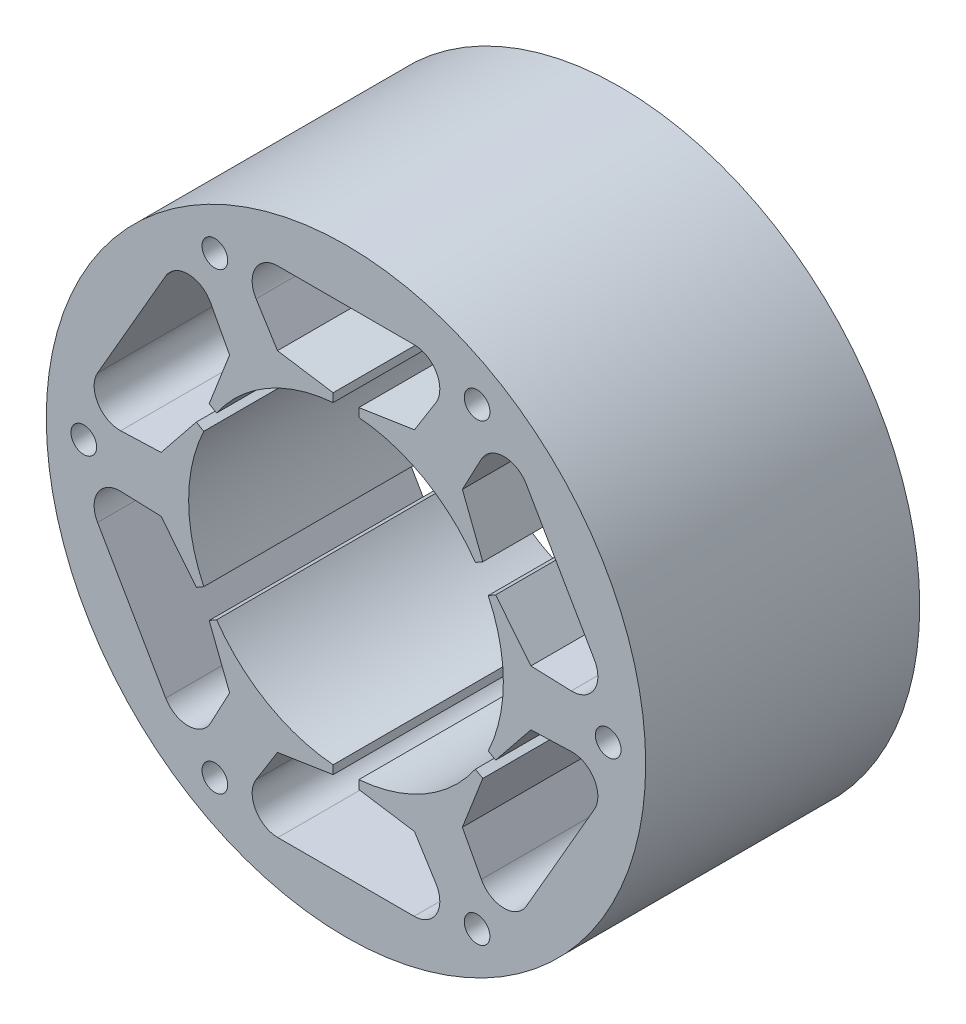
from build123d import *

# Parameters (mm, degrees)
IZIM2_R                     = 35
IZIM2_R_2                   = 1.5
Y_KSEKLIK_EKSTR_ZYON1_DEPTH = 32


with BuildPart() as part:
    # Çizim2 → Yükseklik-Ekstrüzyon1 (new body)
    with BuildSketch(Plane.XY):
        Circle(IZIM2_R)
        with Locations((-15.31013221, -26.517926859)):
            Circle(IZIM2_R_2, mode=Mode.SUBTRACT)
        with Locations((30.62026442, 0)):
            Circle(IZIM2_R_2, mode=Mode.SUBTRACT)
        with Locations((-15.31013221, 26.517926859)):
            Circle(IZIM2_R_2, mode=Mode.SUBTRACT)
        with Locations((15.31013221, 26.517926859)):
            Circle(IZIM2_R_2, mode=Mode.SUBTRACT)
        with Locations((15.31013221, -26.517926859)):
            Circle(IZIM2_R_2, mode=Mode.SUBTRACT)
        with Locations((-30.62026442, 0)):
            Circle(IZIM2_R_2, mode=Mode.SUBTRACT)
        with BuildLine():
            Line((-15.110106202, 10.455874691), (-15.976131606, 10.955874691))
            Line((-15.976131606, 10.955874691), (-13.59215701, 17.085039816))
            Line((-13.59215701, 17.085039816), (-15.806258625, 21.250103325))
            ThreePointArc((-15.806258625, 21.250103325), (-18.402735589, 22.841478137), (-21.05330993, 21.341937514))
            Line((-21.05330993, 21.341937514), (-29.009315019, 7.561732477))
            ThreePointArc((-29.009315019, 7.561732477), (-28.982668121, 4.516497451), (-26.306258625, 3.063569846))
            Line((-26.306258625, 3.063569846), (-21.59215701, 3.228633355))
            Line((-21.59215701, 3.228633355), (-17.476131606, 8.35779848))
            Line((-17.476131606, 8.35779848), (-16.610106202, 7.85779848))
            ThreePointArc((-16.610106202, 7.85779848), (-18.375, 0), (-16.610106202, -7.85779848))
            Line((-16.610106202, -7.85779848), (-17.476131606, -8.35779848))
            Line((-17.476131606, -8.35779848), (-21.59215701, -3.228633355))
            Line((-21.59215701, -3.228633355), (-26.306258625, -3.063569846))
            ThreePointArc((-26.306258625, -3.063569846), (-28.982668121, -4.516497451), (-29.009315018, -7.561732476))
            Line((-29.009315018, -7.561732476), (-21.05330993, -21.341937514))
            ThreePointArc((-21.05330993, -21.341937514), (-18.402735589, -22.841478137), (-15.806258625, -21.250103325))
            Line((-15.806258625, -21.250103325), (-13.59215701, -17.085039816))
            Line((-13.59215701, -17.085039816), (-15.976131606, -10.955874691))
            Line((-15.976131606, -10.955874691), (-15.110106202, -10.455874691))
            ThreePointArc((-15.110106202, -10.455874691), (-9.1875, -15.913216795), (-1.5, -18.313673171))
            Line((-1.5, -18.313673171), (-1.5, -19.313673171))
            Line((-1.5, -19.313673171), (-8, -20.313673171))
            Line((-8, -20.313673171), (-10.5, -24.313673171))
            ThreePointArc((-10.5, -24.313673171), (-10.579932532, -27.357975588), (-7.956005088, -28.903669991))
            Line((-7.956005088, -28.903669991), (7.956005088, -28.903669991))
            ThreePointArc((7.956005088, -28.903669991), (10.579932532, -27.357975588), (10.5, -24.313673171))
            Line((10.5, -24.313673171), (8, -20.313673171))
            Line((8, -20.313673171), (1.5, -19.313673171))
            Line((1.5, -19.313673171), (1.5, -18.313673171))
            ThreePointArc((1.5, -18.313673171), (9.1875, -15.913216795), (15.110106202, -10.455874691))
            Line((15.110106202, -10.455874691), (15.976131606, -10.955874691))
            Line((15.976131606, -10.955874691), (13.59215701, -17.085039816))
            Line((13.59215701, -17.085039816), (15.806258625, -21.250103325))
            ThreePointArc((15.806258625, -21.250103325), (18.402735589, -22.841478137), (21.05330993, -21.341937514))
            Line((21.05330993, -21.341937514), (29.009315019, -7.561732476))
            ThreePointArc((29.009315019, -7.561732476), (28.982668121, -4.516497451), (26.306258625, -3.063569846))
            Line((26.306258625, -3.063569846), (21.59215701, -3.228633355))
            Line((21.59215701, -3.228633355), (17.476131606, -8.35779848))
            Line((17.476131606, -8.35779848), (16.610106202, -7.85779848))
            ThreePointArc((16.610106202, -7.85779848), (18.375, 0), (16.610106202, 7.85779848))
            Line((16.610106202, 7.85779848), (17.476131606, 8.35779848))
            Line((17.476131606, 8.35779848), (21.59215701, 3.228633355))
            Line((21.59215701, 3.228633355), (26.306258625, 3.063569846))
            ThreePointArc((26.306258625, 3.063569846), (28.982668121, 4.516497451), (29.009315018, 7.561732476))
            Line((29.009315018, 7.561732476), (21.05330993, 21.341937514))
            ThreePointArc((21.05330993, 21.341937514), (18.402735589, 22.841478137), (15.806258625, 21.250103325))
            Line((15.806258625, 21.250103325), (13.59215701, 17.085039816))
            Line((13.59215701, 17.085039816), (15.976131606, 10.955874691))
            Line((15.976131606, 10.955874691), (15.110106202, 10.455874691))
            ThreePointArc((15.110106202, 10.455874691), (9.1875, 15.913216795), (1.5, 18.313673171))
            Line((1.5, 18.313673171), (1.5, 19.313673171))
            Line((1.5, 19.313673171), (8, 20.313673171))
            Line((8, 20.313673171), (10.5, 24.313673171))
            ThreePointArc((10.5, 24.313673171), (10.579932532, 27.357975588), (7.956005088, 28.903669991))
            Line((7.956005088, 28.903669991), (-7.956005088, 28.903669991))
            ThreePointArc((-7.956005088, 28.903669991), (-10.579932532, 27.357975588), (-10.5, 24.313673171))
            Line((-10.5, 24.313673171), (-8, 20.313673171))
            Line((-8, 20.313673171), (-1.5, 19.313673171))
            Line((-1.5, 19.313673171), (-1.5, 18.313673171))
            ThreePointArc((-1.5, 18.313673171), (-9.1875, 15.913216795), (-15.110106202, 10.455874691))
        make_face(mode=Mode.SUBTRACT)
    extrude(amount=Y_KSEKLIK_EKSTR_ZYON1_DEPTH)


solid = part.part
